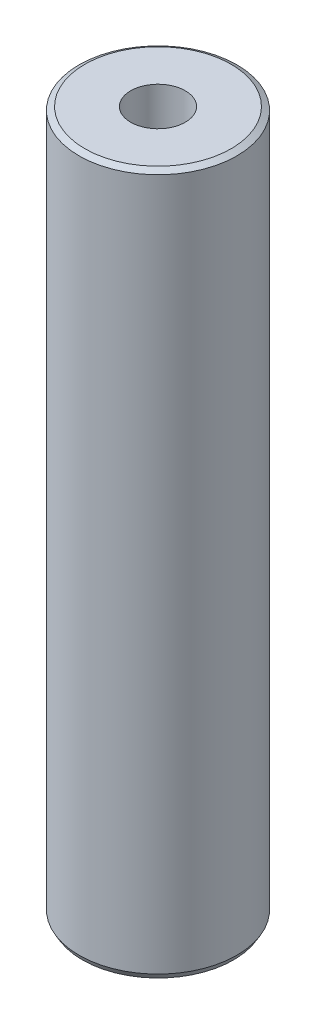
from build123d import *
from OCP.BRepFilletAPI import BRepFilletAPI_MakeChamfer

# Parameters (mm, degrees)
SKETCH1_R           = 30
BOSS_EXTRUDE1_DEPTH = 266.582401217
SKETCH2_R           = 10.380075765
CUT_EXTRUDE1_DEPTH  = 270.937356879
CHAMFER1_SIZE       = 1.261658206
CHAMFER1_SIZE2      = 2.185256115


with BuildPart() as part:
    # Sketch1 → Boss-Extrude1 (new body)
    with BuildSketch(Plane(origin=(0, 0, 0), x_dir=(1, 0, 0), z_dir=(0, 1, 0))):
        Circle(SKETCH1_R)
    extrude(amount=BOSS_EXTRUDE1_DEPTH)

    # Sketch2 → Cut-Extrude1 (cut, through all)
    with BuildSketch(Plane(origin=(0, 0, 0), x_dir=(1, 0, 0), z_dir=(0, 1, 0))):
        Circle(SKETCH2_R)
    extrude(amount=CUT_EXTRUDE1_DEPTH, mode=Mode.SUBTRACT)

    # Chamfer1: one chamfer whose edges measure the first distance from different faces: ONE call of the kernel's chamfer builder (chamfer() names one face for all edges)
    chamfer1_edges_1 = [part.edges().sort_by_distance(p)[0] for p in [
        (-30, 266.582401217, 0),
    ]]
    chamfer1_side_1 = [part.faces().sort_by_distance(p)[0] for p in [
        (-30, 133.291200609, 0),
    ]]
    chamfer1_edges_2 = [part.edges().sort_by_distance(p)[0] for p in [
        (-30, 0, 0),
    ]]
    chamfer1_side_2 = [part.faces().sort_by_distance(p)[0] for p in [
        (-29.151471863, 0, 0),
    ]]
    chamfer1 = BRepFilletAPI_MakeChamfer(part.part.solid().wrapped)
    for e in chamfer1_edges_1:
        chamfer1.Add(CHAMFER1_SIZE, CHAMFER1_SIZE2, e.wrapped, chamfer1_side_1[0].wrapped)  # the first distance lies on this face
    for e in chamfer1_edges_2:
        chamfer1.Add(CHAMFER1_SIZE, CHAMFER1_SIZE2, e.wrapped, chamfer1_side_2[0].wrapped)  # the first distance lies on this face
    add(Compound.cast(chamfer1.Shape()), mode=Mode.REPLACE)


solid = part.part
